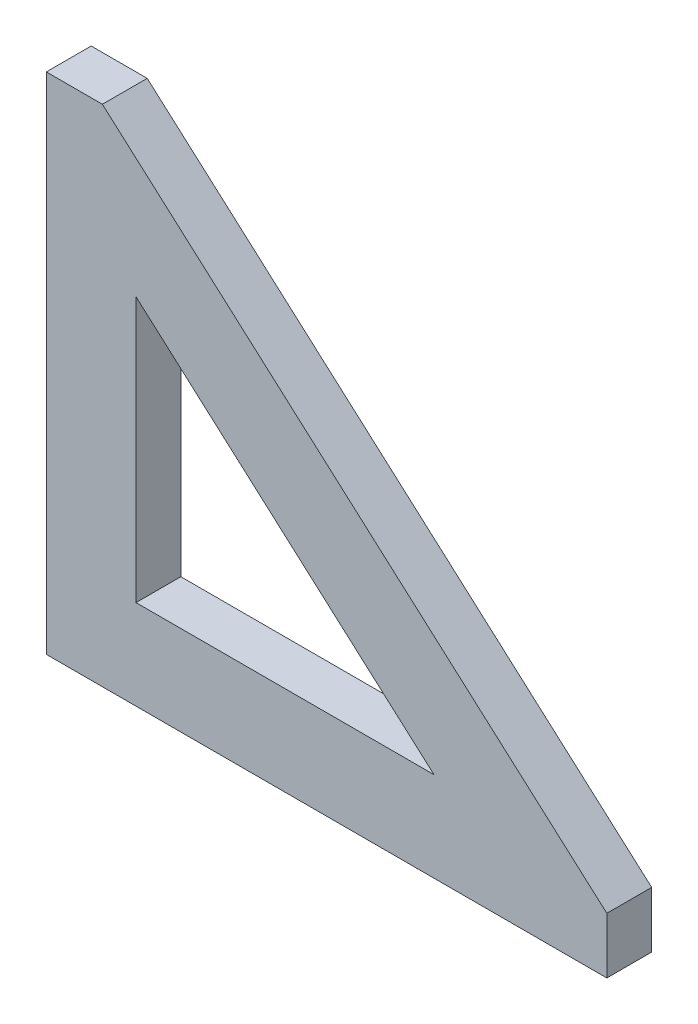
from build123d import *

# Parameters (mm, degrees)
EXTRUDE_1_DEPTH = 4


with BuildPart() as part:
    # 草图1 → 凸台-拉伸1 (new, symmetric)
    with BuildSketch(Plane.XY):
        Polygon((0, 0), (100, 0), (100, 10), (10, 90), (0, 90), align=None)
        Polygon((16, 63.259387415), (69.166810842, 16), (16, 16), align=None, mode=Mode.SUBTRACT)
    extrude(amount=EXTRUDE_1_DEPTH, both=True)


solid = part.part
